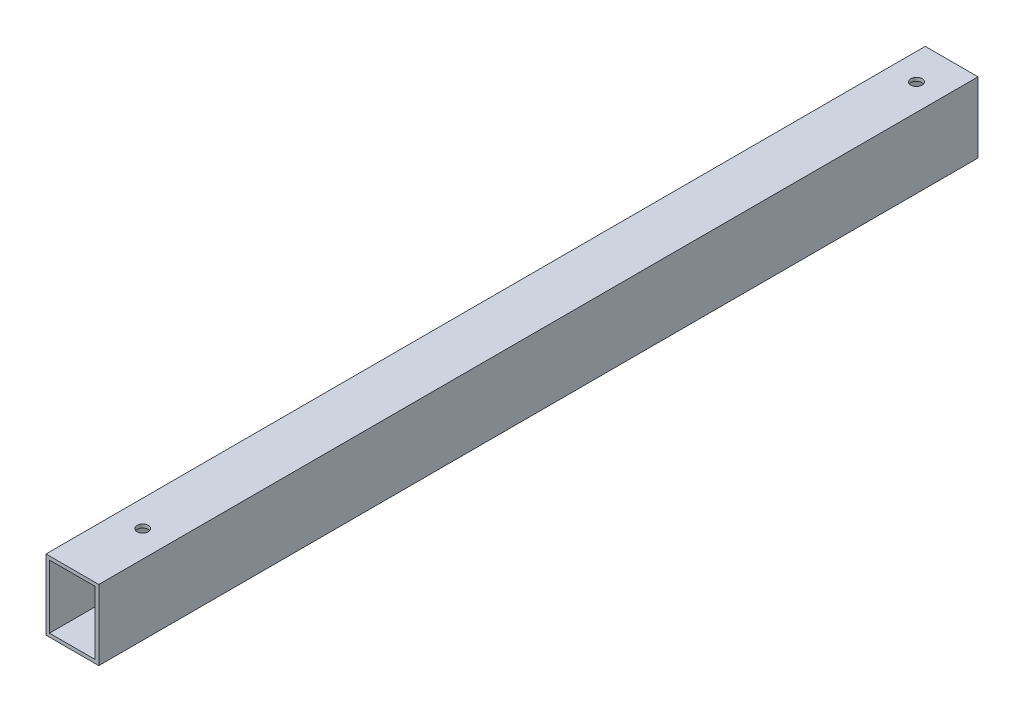
from build123d import *

# Parameters (mm, degrees)
SKETCH_1_W          = 15
SKETCH_1_H          = 20
SKETCH_1_W_2        = 13
SKETCH_1_H_2        = 18
EXTRUDE_1_DEPTH     = 250
SKETCH_3_R          = 1.6
CUT_EXTRUDE_2_DEPTH = 252.246890528


with BuildPart() as part:
    # 草图1 → 拉伸-薄壁1 (new body)
    with BuildSketch(Plane.XY):
        with Locations((7.5, -10)):
            Rectangle(SKETCH_1_W, SKETCH_1_H)
        with Locations((7.5, -10)):
            Rectangle(SKETCH_1_W_2, SKETCH_1_H_2, mode=Mode.SUBTRACT)
    extrude(amount=EXTRUDE_1_DEPTH)

    # 草图3 → 切除-拉伸2 (cut, through all)
    with BuildSketch(Plane(origin=(0, 0, 0), x_dir=(1, 0, 0), z_dir=(0, 1, 0))):
        with Locations((7.5, -10)):
            Circle(SKETCH_3_R)
        with Locations((7.5, -230)):
            Circle(SKETCH_3_R)
    extrude(amount=-CUT_EXTRUDE_2_DEPTH, mode=Mode.SUBTRACT)


solid = part.part
